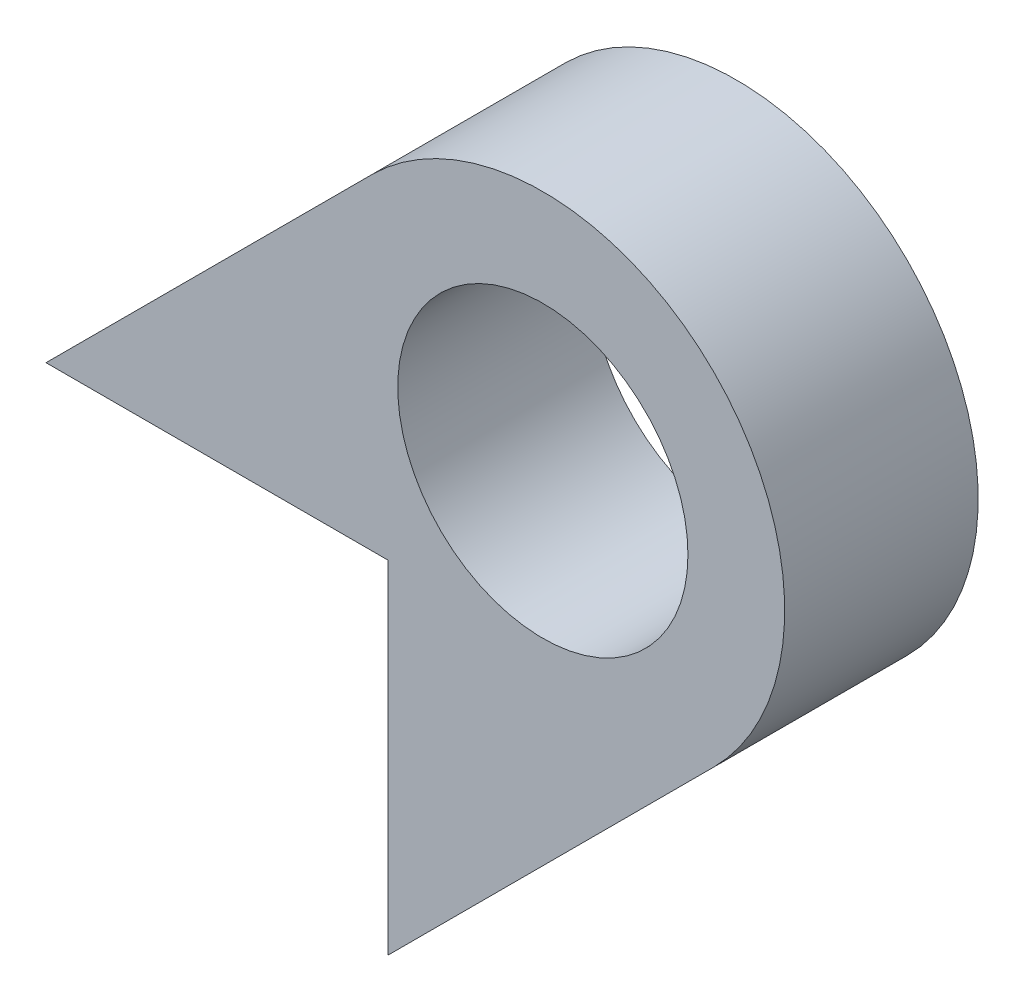
from build123d import *

# Parameters (mm, degrees)
SKETCH1_R           = 7.5
BOSS_EXTRUDE1_DEPTH = 10


with BuildPart() as part:
    # Sketch1 → Boss-Extrude1 (new body)
    with BuildSketch(Plane.XY):
        with BuildLine():
            Line((-8, -8), (-8, -25.67766953))
            Line((-8, -25.67766953), (8.838834765, -8.838834765))
            ThreePointArc((8.838834765, -8.838834765), (8.838834765, 8.838834765), (-8.838834765, 8.838834765))
            Line((-8.838834765, 8.838834765), (-25.67766953, -8))
            Line((-25.67766953, -8), (-8, -8))
        make_face()
        Circle(SKETCH1_R, mode=Mode.SUBTRACT)
    extrude(amount=BOSS_EXTRUDE1_DEPTH)


solid = part.part
